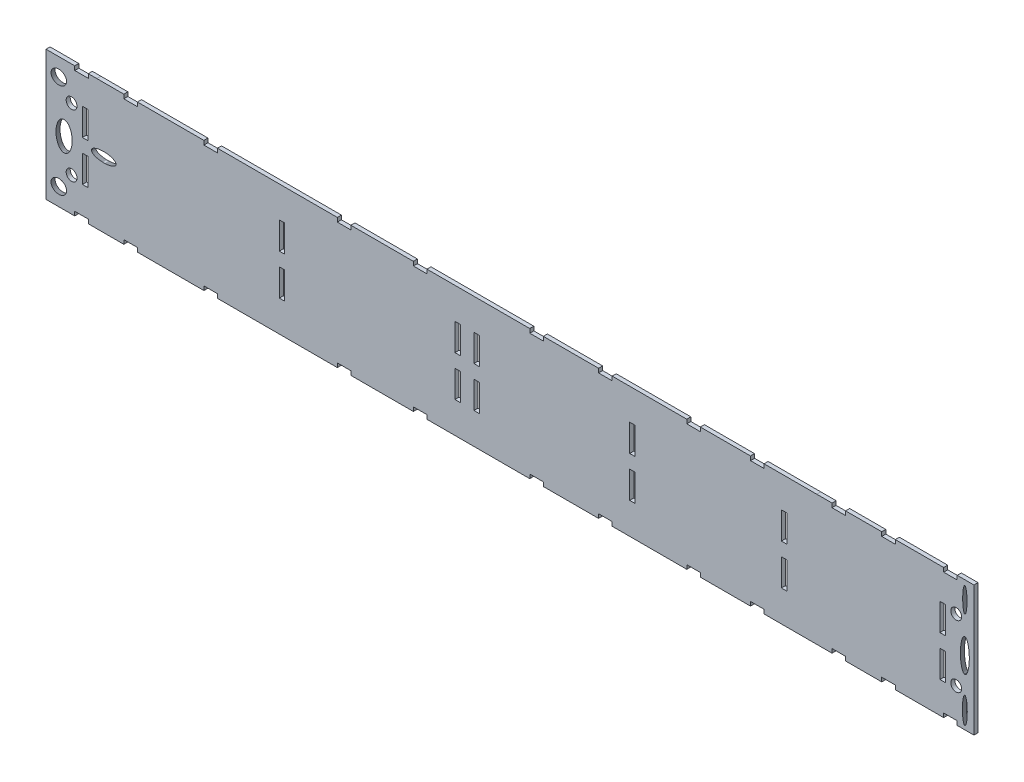
from build123d import *

# Parameters (mm, degrees)
MODEL_R         = 2
MODEL_W         = 2
MODEL_H         = 10
EXTRUDE_1_DEPTH = 1.5


with BuildPart() as part:
    # Model → 凸台-拉伸1 (new body)
    with BuildSketch(Plane.XY):
        Polygon((338.285269169, 1.723672188), (348.246710328, 1.723672188), (348.246710328, 3.223672188), (353.246710328, 3.223672188), (353.246710328, 1.723672188), (377.800303431, 1.723672188), (377.800303431, 3.223677419), (382.800303431, 3.223677419), (382.800303431, 1.723672188), (412.523752943, 1.723672188), (427.042567104, 1.723672188), (427.042567104, 3.223677419), (432.042567104, 3.223677419), (432.042567104, 1.723672188), (436.523752943, 1.723672188), (455.110365553, 1.723672188), (455.110365553, 3.223677419), (460.110365553, 3.223677419), (460.110365553, 1.723672188), (484.606799213, 1.723672188), (498.059086053, 1.723672188), (498.059086053, 3.223677419), (503.059086053, 3.223677419), (503.059086053, 1.723672188), (523.456352673, 1.723672188), (523.456352673, 3.223677419), (528.456352673, 3.223677419), (528.456352673, 1.723672188), (548.298752943, 1.723672188), (556.008423825, 1.723672188), (556.008423825, 3.223677419), (561.008423825, 3.223677419), (561.008423825, 1.723672188), (579.524411936, 1.723672188), (579.524411936, 3.223677419), (584.524411936, 3.223677419), (584.524411936, 1.723672188), (598.298752943, 1.723672188), (609.624868079, 1.723672188), (609.624868079, 3.223672188), (614.624868079, 3.223672188), (614.624868079, 1.723672188), (627.967343665, 1.723672188), (627.967343665, 3.223672188), (632.967343665, 3.223672188), (632.967343665, 1.723672188), (646.116355135, 1.723672188), (650.81890486, 1.723677108), (650.81890486, 3.223682339), (655.81890486, 3.223682339), (655.81890486, 1.723682339), (661.99042954, 1.723688796), (661.990379277, 49.723628095), (655.81890486, 49.723628095), (655.81890486, 48.223628095), (650.81890486, 48.223628095), (650.81890486, 49.723628095), (646.116355234, 49.723628095), (632.967343665, 49.723641853), (632.967343665, 48.223641853), (627.967343665, 48.223641853), (627.967343665, 49.723647084), (614.624868079, 49.723661044), (614.624868079, 48.223661044), (609.624868079, 48.223661044), (609.624868079, 49.723666275), (603.973752943, 49.723672188), (598.298752943, 49.723672188), (584.524411936, 49.723672188), (584.524411936, 48.223672188), (579.524411936, 48.223672188), (579.524411936, 49.723672188), (561.008423825, 49.723672188), (561.008423825, 48.223672188), (556.008423825, 48.223672188), (556.008423825, 49.723672188), (548.298752943, 49.723672188), (528.456352673, 49.723672188), (528.456352673, 48.223672188), (523.456352673, 48.223672188), (523.456352673, 49.723672188), (503.059086053, 49.723672188), (503.059086053, 48.223672188), (498.059086053, 48.223672188), (498.059086053, 49.723672188), (484.606799213, 49.723672188), (460.110365553, 49.723672188), (460.110365553, 48.223672188), (455.110365553, 48.223672188), (455.110365553, 49.723672188), (436.523752943, 49.723672188), (432.042567104, 49.723672188), (432.042567104, 48.223672188), (427.042567104, 48.223672188), (427.042567104, 49.723672188), (412.523752943, 49.723672188), (382.800303431, 49.723672188), (382.800303431, 48.223672188), (377.800303431, 48.223672188), (377.800303431, 49.723672188), (353.246710328, 49.723672188), (353.246710328, 48.223672188), (348.246710328, 48.223672188), (348.246710328, 49.723672188), (338.285269169, 49.723672188), (335.131667994, 49.72371628), (335.131667994, 48.22371628), (330.131667994, 48.22371628), (330.131667994, 49.72371628), (319.523752943, 49.72371628), (319.523752943, 1.72371628), (330.131667994, 1.72371628), (330.131667994, 3.22371628), (335.131667994, 3.22371628), (335.131667994, 1.72371628), align=None)
        with Locations((655.438565964, 14.223656604)):
            Circle(MODEL_R, mode=Mode.SUBTRACT)
        with Locations((655.438571133, 37.223656604)):
            Circle(MODEL_R, mode=Mode.SUBTRACT)
        with Locations((328.963055855, 37.223694234)):
            Circle(MODEL_R, mode=Mode.SUBTRACT)
        with Locations((328.963055855, 14.223694234)):
            Circle(MODEL_R, mode=Mode.SUBTRACT)
        with Locations((406.620149255, 33.223672188)):
            Rectangle(MODEL_W, MODEL_H, mode=Mode.SUBTRACT)
        with Locations((406.620149255, 18.223672188)):
            Rectangle(MODEL_W, MODEL_H, mode=Mode.SUBTRACT)
        with Locations((591.928319664, 33.223672188)):
            Rectangle(MODEL_W, MODEL_H, mode=Mode.SUBTRACT)
        with Locations((591.928319664, 18.223672188)):
            Rectangle(MODEL_W, MODEL_H, mode=Mode.SUBTRACT)
        with Locations((471.459111563, 33.223672188)):
            Rectangle(MODEL_W, MODEL_H, mode=Mode.SUBTRACT)
        with Locations((471.459111563, 18.223672188)):
            Rectangle(MODEL_W, MODEL_H, mode=Mode.SUBTRACT)
        with Locations((478.459111563, 33.223672188)):
            Rectangle(MODEL_W, MODEL_H, mode=Mode.SUBTRACT)
        with Locations((478.459111563, 18.223672188)):
            Rectangle(MODEL_W, MODEL_H, mode=Mode.SUBTRACT)
        with Locations((535.952910082, 33.223672188)):
            Rectangle(MODEL_W, MODEL_H, mode=Mode.SUBTRACT)
        with Locations((535.952910082, 18.223672188)):
            Rectangle(MODEL_W, MODEL_H, mode=Mode.SUBTRACT)
        with Locations((333.962643836, 18.22371628)):
            Rectangle(MODEL_W, MODEL_H, mode=Mode.SUBTRACT)
        with Locations((333.962643836, 33.22371628)):
            Rectangle(MODEL_W, MODEL_H, mode=Mode.SUBTRACT)
        with Locations((650.439397184, 33.223628095)):
            Rectangle(MODEL_W, MODEL_H, mode=Mode.SUBTRACT)
        with Locations((650.439397184, 18.223628095)):
            Rectangle(MODEL_W, MODEL_H, mode=Mode.SUBTRACT)
        Polygon((345.366429852, 25.861922765), (345.360429852, 25.771922765), (345.344429852, 25.691922765), (345.316429852, 25.601922765), (345.278429852, 25.511922765), (345.230429852, 25.431922765), (345.170429852, 25.341922765), (345.100429852, 25.261922765), (345.020429852, 25.181922765), (344.930429852, 25.101922765), (344.829429852, 25.021922765), (344.720429852, 24.941922765), (344.600429852, 24.871922765), (344.472429852, 24.801922765), (344.335429852, 24.731922765), (344.189429852, 24.661922765), (344.036429852, 24.601922765), (343.874429852, 24.541922765), (343.705429852, 24.481922765), (343.530429852, 24.431922765), (343.347429852, 24.381922765), (343.159429852, 24.331922765), (342.965429852, 24.291922765), (342.766429852, 24.251922765), (342.562429852, 24.211922765), (342.354429852, 24.181922765), (342.143429852, 24.151922765), (341.928429852, 24.131922765), (341.710429852, 24.111922765), (341.491429852, 24.101922765), (341.270429852, 24.081922765), (341.047429852, 24.081922765), (340.825429852, 24.081922765), (340.602429852, 24.081922765), (340.379429852, 24.081922765), (340.158429852, 24.101922765), (339.939429852, 24.111922765), (339.721429852, 24.131922765), (339.506429852, 24.151922765), (339.295429852, 24.181922765), (339.087429852, 24.211922765), (338.883429852, 24.251922765), (338.684429852, 24.291922765), (338.490429852, 24.331922765), (338.302429852, 24.381922765), (338.119429852, 24.431922765), (337.944429852, 24.481922765), (337.775429852, 24.541922765), (337.613429852, 24.601922765), (337.460429852, 24.661922765), (337.314429852, 24.731922765), (337.177429852, 24.801922765), (337.049429852, 24.871922765), (336.929429852, 24.941922765), (336.820429852, 25.021922765), (336.719429852, 25.101922765), (336.629429852, 25.181922765), (336.549429852, 25.261922765), (336.479429852, 25.341922765), (336.419429852, 25.431922765), (336.371429852, 25.511922765), (336.333429852, 25.601922765), (336.305429852, 25.691922765), (336.289429852, 25.771922765), (336.283429852, 25.861922765), (336.289429852, 25.951922765), (336.305429852, 26.041922765), (336.333429852, 26.121922765), (336.371429852, 26.211922765), (336.419429852, 26.291922765), (336.479429852, 26.381922765), (336.549429852, 26.461922765), (336.629429852, 26.541922765), (336.719429852, 26.621922765), (336.820429852, 26.701922765), (336.929429852, 26.781922765), (337.049429852, 26.851922765), (337.177429852, 26.921922765), (337.314429852, 26.991922765), (337.460429852, 27.061922765), (337.613429852, 27.121922765), (337.775429852, 27.181922765), (337.944429852, 27.241922765), (338.119429852, 27.291922765), (338.302429852, 27.341922765), (338.490429852, 27.391922765), (338.684429852, 27.431922765), (338.883429852, 27.471922765), (339.087429852, 27.511922765), (339.295429852, 27.541922765), (339.506429852, 27.571922765), (339.721429852, 27.591922765), (339.939429852, 27.611922765), (340.158429852, 27.631922765), (340.379429852, 27.641922765), (340.602429852, 27.641922765), (340.825429852, 27.651922765), (341.047429852, 27.641922765), (341.270429852, 27.641922765), (341.491429852, 27.631922765), (341.710429852, 27.611922765), (341.928429852, 27.591922765), (342.143429852, 27.571922765), (342.354429852, 27.541922765), (342.562429852, 27.511922765), (342.766429852, 27.471922765), (342.965429852, 27.431922765), (343.159429852, 27.391922765), (343.347429852, 27.341922765), (343.530429852, 27.291922765), (343.705429852, 27.241922765), (343.874429852, 27.181922765), (344.036429852, 27.121922765), (344.189429852, 27.061922765), (344.335429852, 26.991922765), (344.472429852, 26.921922765), (344.600429852, 26.851922765), (344.720429852, 26.781922765), (344.829429852, 26.701922765), (344.930429852, 26.621922765), (345.020429852, 26.541922765), (345.100429852, 26.461922765), (345.170429852, 26.381922765), (345.230429852, 26.291922765), (345.278429852, 26.211922765), (345.316429852, 26.121922765), (345.344429852, 26.041922765), (345.360429852, 25.951922765), align=None, mode=Mode.SUBTRACT)
        Polygon((326.195429852, 19.921922765), (326.049429852, 19.921922765), (325.902429852, 19.941922765), (325.757429852, 19.981922765), (325.612429852, 20.021922765), (325.469429852, 20.081922765), (325.328429852, 20.151922765), (325.189429852, 20.231922765), (325.052429852, 20.321922765), (324.918429852, 20.431922765), (324.787429852, 20.551922765), (324.660429852, 20.681922765), (324.536429852, 20.821922765), (324.416429852, 20.971922765), (324.300429852, 21.131922765), (324.189429852, 21.301922765), (324.083429852, 21.481922765), (323.982429852, 21.671922765), (323.886429852, 21.871922765), (323.796429852, 22.081922765), (323.712429852, 22.291922765), (323.633429852, 22.511922765), (323.561429852, 22.741922765), (323.495429852, 22.981922765), (323.436429852, 23.221922765), (323.383429852, 23.461922765), (323.337429852, 23.711922765), (323.298429852, 23.961922765), (323.266429852, 24.221922765), (323.241429852, 24.481922765), (323.223429852, 24.741922765), (323.212429852, 25.001922765), (323.208429852, 25.261922765), (323.212429852, 25.521922765), (323.223429852, 25.791922765), (323.241429852, 26.051922765), (323.266429852, 26.301922765), (323.298429852, 26.561922765), (323.337429852, 26.811922765), (323.383429852, 27.061922765), (323.436429852, 27.311922765), (323.495429852, 27.551922765), (323.561429852, 27.781922765), (323.633429852, 28.011922765), (323.712429852, 28.231922765), (323.796429852, 28.451922765), (323.886429852, 28.651922765), (323.982429852, 28.851922765), (324.083429852, 29.041922765), (324.189429852, 29.221922765), (324.300429852, 29.391922765), (324.416429852, 29.551922765), (324.536429852, 29.711922765), (324.660429852, 29.851922765), (324.787429852, 29.981922765), (324.918429852, 30.091922765), (325.052429852, 30.201922765), (325.189429852, 30.291922765), (325.328429852, 30.381922765), (325.469429852, 30.451922765), (325.612429852, 30.501922765), (325.757429852, 30.551922765), (325.902429852, 30.581922765), (326.049429852, 30.601922765), (326.195429852, 30.611922765), (326.342429852, 30.601922765), (326.488429852, 30.581922765), (326.633429852, 30.551922765), (326.778429852, 30.501922765), (326.921429852, 30.451922765), (327.062429852, 30.381922765), (327.201429852, 30.291922765), (327.338429852, 30.201922765), (327.472429852, 30.091922765), (327.603429852, 29.981922765), (327.731429852, 29.851922765), (327.855429852, 29.711922765), (327.974429852, 29.551922765), (328.090429852, 29.391922765), (328.201429852, 29.221922765), (328.307429852, 29.041922765), (328.408429852, 28.851922765), (328.504429852, 28.651922765), (328.594429852, 28.451922765), (328.679429852, 28.231922765), (328.757429852, 28.011922765), (328.829429852, 27.781922765), (328.895429852, 27.551922765), (328.955429852, 27.311922765), (329.008429852, 27.061922765), (329.053429852, 26.811922765), (329.093429852, 26.561922765), (329.125429852, 26.301922765), (329.150429852, 26.051922765), (329.168429852, 25.791922765), (329.179429852, 25.521922765), (329.182429852, 25.261922765), (329.179429852, 25.001922765), (329.168429852, 24.741922765), (329.150429852, 24.481922765), (329.125429852, 24.221922765), (329.093429852, 23.961922765), (329.053429852, 23.711922765), (329.008429852, 23.461922765), (328.955429852, 23.221922765), (328.895429852, 22.981922765), (328.829429852, 22.741922765), (328.757429852, 22.511922765), (328.679429852, 22.291922765), (328.594429852, 22.081922765), (328.504429852, 21.871922765), (328.408429852, 21.671922765), (328.307429852, 21.481922765), (328.201429852, 21.301922765), (328.090429852, 21.131922765), (327.974429852, 20.971922765), (327.855429852, 20.821922765), (327.731429852, 20.681922765), (327.603429852, 20.551922765), (327.472429852, 20.431922765), (327.338429852, 20.321922765), (327.201429852, 20.231922765), (327.062429852, 20.151922765), (326.921429852, 20.081922765), (326.778429852, 20.021922765), (326.633429852, 19.981922765), (326.488429852, 19.941922765), (326.342429852, 19.921922765), align=None, mode=Mode.SUBTRACT)
        Polygon((321.382429852, 8.251922765), (321.385429852, 8.371922765), (321.396429852, 8.501922765), (321.413429852, 8.621922765), (321.437429852, 8.741922765), (321.468429852, 8.871922765), (321.505429852, 8.991922765), (321.549429852, 9.101922765), (321.600429852, 9.221922765), (321.657429852, 9.331922765), (321.720429852, 9.441922765), (321.789429852, 9.551922765), (321.865429852, 9.661922765), (321.945429852, 9.761922765), (322.032429852, 9.861922765), (322.124429852, 9.951922765), (322.221429852, 10.041922765), (322.322429852, 10.131922765), (322.429429852, 10.211922765), (322.540429852, 10.281922765), (322.654429852, 10.361922765), (322.773429852, 10.421922765), (322.895429852, 10.481922765), (323.021429852, 10.541922765), (323.149429852, 10.591922765), (323.281429852, 10.641922765), (323.414429852, 10.671922765), (323.549429852, 10.711922765), (323.687429852, 10.731922765), (323.825429852, 10.761922765), (323.965429852, 10.771922765), (324.105429852, 10.781922765), (324.245429852, 10.781922765), (324.386429852, 10.781922765), (324.526429852, 10.771922765), (324.665429852, 10.761922765), (324.804429852, 10.731922765), (324.941429852, 10.711922765), (325.076429852, 10.671922765), (325.210429852, 10.641922765), (325.341429852, 10.591922765), (325.469429852, 10.541922765), (325.595429852, 10.481922765), (325.717429852, 10.421922765), (325.836429852, 10.361922765), (325.951429852, 10.281922765), (326.062429852, 10.211922765), (326.168429852, 10.131922765), (326.270429852, 10.041922765), (326.367429852, 9.951922765), (326.458429852, 9.861922765), (326.545429852, 9.761922765), (326.626429852, 9.661922765), (326.701429852, 9.551922765), (326.770429852, 9.441922765), (326.833429852, 9.331922765), (326.890429852, 9.221922765), (326.941429852, 9.101922765), (326.985429852, 8.991922765), (327.023429852, 8.871922765), (327.053429852, 8.741922765), (327.077429852, 8.621922765), (327.095429852, 8.501922765), (327.105429852, 8.371922765), (327.108429852, 8.251922765), (327.105429852, 8.131922765), (327.095429852, 8.001922765), (327.077429852, 7.881922765), (327.053429852, 7.761922765), (327.023429852, 7.631922765), (326.985429852, 7.511922765), (326.941429852, 7.401922765), (326.890429852, 7.281922765), (326.833429852, 7.171922765), (326.770429852, 7.061922765), (326.701429852, 6.951922765), (326.626429852, 6.841922765), (326.545429852, 6.741922765), (326.458429852, 6.641922765), (326.367429852, 6.551922765), (326.270429852, 6.461922765), (326.168429852, 6.371922765), (326.062429852, 6.291922765), (325.951429852, 6.211922765), (325.836429852, 6.141922765), (325.717429852, 6.081922765), (325.595429852, 6.021922765), (325.469429852, 5.961922765), (325.341429852, 5.911922765), (325.210429852, 5.861922765), (325.076429852, 5.831922765), (324.941429852, 5.791922765), (324.804429852, 5.761922765), (324.665429852, 5.741922765), (324.526429852, 5.731922765), (324.386429852, 5.721922765), (324.245429852, 5.721922765), (324.105429852, 5.721922765), (323.965429852, 5.731922765), (323.825429852, 5.741922765), (323.687429852, 5.761922765), (323.549429852, 5.791922765), (323.414429852, 5.831922765), (323.281429852, 5.861922765), (323.149429852, 5.911922765), (323.021429852, 5.961922765), (322.895429852, 6.021922765), (322.773429852, 6.081922765), (322.654429852, 6.141922765), (322.540429852, 6.211922765), (322.429429852, 6.291922765), (322.322429852, 6.371922765), (322.221429852, 6.461922765), (322.124429852, 6.551922765), (322.032429852, 6.641922765), (321.945429852, 6.741922765), (321.865429852, 6.841922765), (321.789429852, 6.951922765), (321.720429852, 7.061922765), (321.657429852, 7.171922765), (321.600429852, 7.281922765), (321.549429852, 7.401922765), (321.505429852, 7.511922765), (321.468429852, 7.631922765), (321.437429852, 7.761922765), (321.413429852, 7.881922765), (321.396429852, 8.001922765), (321.385429852, 8.131922765), align=None, mode=Mode.SUBTRACT)
        Polygon((321.382429852, 43.191922765), (321.385429852, 43.071922765), (321.396429852, 42.951922765), (321.413429852, 42.821922765), (321.437429852, 42.701922765), (321.468429852, 42.581922765), (321.505429852, 42.461922765), (321.549429852, 42.341922765), (321.600429852, 42.221922765), (321.657429852, 42.111922765), (321.720429852, 42.001922765), (321.789429852, 41.891922765), (321.865429852, 41.791922765), (321.945429852, 41.681922765), (322.032429852, 41.591922765), (322.124429852, 41.491922765), (322.221429852, 41.401922765), (322.322429852, 41.321922765), (322.429429852, 41.241922765), (322.540429852, 41.161922765), (322.655429852, 41.091922765), (322.773429852, 41.021922765), (322.896429852, 40.961922765), (323.021429852, 40.901922765), (323.150429852, 40.851922765), (323.281429852, 40.811922765), (323.414429852, 40.771922765), (323.550429852, 40.741922765), (323.687429852, 40.711922765), (323.825429852, 40.691922765), (323.965429852, 40.671922765), (324.105429852, 40.661922765), (324.245429852, 40.661922765), (324.386429852, 40.661922765), (324.526429852, 40.671922765), (324.665429852, 40.691922765), (324.804429852, 40.711922765), (324.941429852, 40.741922765), (325.076429852, 40.771922765), (325.210429852, 40.811922765), (325.341429852, 40.851922765), (325.469429852, 40.901922765), (325.595429852, 40.961922765), (325.717429852, 41.021922765), (325.836429852, 41.091922765), (325.951429852, 41.161922765), (326.062429852, 41.241922765), (326.168429852, 41.321922765), (326.270429852, 41.401922765), (326.367429852, 41.491922765), (326.458429852, 41.591922765), (326.545429852, 41.681922765), (326.626429852, 41.791922765), (326.701429852, 41.891922765), (326.770429852, 42.001922765), (326.833429852, 42.111922765), (326.890429852, 42.221922765), (326.941429852, 42.341922765), (326.985429852, 42.461922765), (327.023429852, 42.581922765), (327.053429852, 42.701922765), (327.077429852, 42.821922765), (327.095429852, 42.951922765), (327.105429852, 43.071922765), (327.108429852, 43.191922765), (327.105429852, 43.321922765), (327.095429852, 43.441922765), (327.077429852, 43.571922765), (327.053429852, 43.691922765), (327.023429852, 43.811922765), (326.985429852, 43.931922765), (326.941429852, 44.051922765), (326.890429852, 44.161922765), (326.833429852, 44.281922765), (326.770429852, 44.391922765), (326.701429852, 44.501922765), (326.626429852, 44.601922765), (326.545429852, 44.701922765), (326.458429852, 44.801922765), (326.367429852, 44.901922765), (326.270429852, 44.991922765), (326.168429852, 45.071922765), (326.062429852, 45.151922765), (325.951429852, 45.231922765), (325.836429852, 45.301922765), (325.717429852, 45.371922765), (325.595429852, 45.431922765), (325.469429852, 45.481922765), (325.341429852, 45.531922765), (325.210429852, 45.581922765), (325.076429852, 45.621922765), (324.941429852, 45.651922765), (324.804429852, 45.681922765), (324.665429852, 45.701922765), (324.526429852, 45.721922765), (324.386429852, 45.721922765), (324.245429852, 45.731922765), (324.105429852, 45.721922765), (323.965429852, 45.721922765), (323.825429852, 45.701922765), (323.687429852, 45.681922765), (323.550429852, 45.651922765), (323.414429852, 45.621922765), (323.281429852, 45.581922765), (323.150429852, 45.531922765), (323.021429852, 45.481922765), (322.896429852, 45.431922765), (322.773429852, 45.371922765), (322.655429852, 45.301922765), (322.540429852, 45.231922765), (322.429429852, 45.151922765), (322.322429852, 45.071922765), (322.221429852, 44.991922765), (322.124429852, 44.901922765), (322.032429852, 44.801922765), (321.945429852, 44.701922765), (321.865429852, 44.601922765), (321.789429852, 44.501922765), (321.720429852, 44.391922765), (321.657429852, 44.281922765), (321.600429852, 44.161922765), (321.549429852, 44.051922765), (321.505429852, 43.931922765), (321.468429852, 43.811922765), (321.437429852, 43.691922765), (321.413429852, 43.571922765), (321.396429852, 43.441922765), (321.385429852, 43.321922765), align=None, mode=Mode.SUBTRACT)
        Polygon((658.632114556, 31.512707321), (658.552114556, 31.512707321), (658.471114556, 31.492707321), (658.391114556, 31.452707321), (658.312114556, 31.402707321), (658.233114556, 31.332707321), (658.156114556, 31.252707321), (658.079114556, 31.162707321), (658.004114556, 31.062707321), (657.931114556, 30.932707321), (657.859114556, 30.802707321), (657.789114556, 30.662707321), (657.721114556, 30.502707321), (657.655114556, 30.332707321), (657.591114556, 30.142707321), (657.530114556, 29.952707321), (657.472114556, 29.752707321), (657.417114556, 29.532707321), (657.364114556, 29.312707321), (657.314114556, 29.072707321), (657.268114556, 28.832707321), (657.225114556, 28.582707321), (657.185114556, 28.322707321), (657.149114556, 28.062707321), (657.116114556, 27.792707321), (657.088114556, 27.512707321), (657.062114556, 27.232707321), (657.041114556, 26.952707321), (657.023114556, 26.662707321), (657.009114556, 26.362707321), (657.000114556, 26.072707321), (656.994114556, 25.782707321), (656.992114556, 25.482707321), (656.994114556, 25.182707321), (657.000114556, 24.892707321), (657.009114556, 24.592707321), (657.023114556, 24.302707321), (657.041114556, 24.012707321), (657.062114556, 23.732707321), (657.088114556, 23.452707321), (657.116114556, 23.172707321), (657.149114556, 22.902707321), (657.185114556, 22.632707321), (657.225114556, 22.382707321), (657.268114556, 22.132707321), (657.314114556, 21.882707321), (657.364114556, 21.652707321), (657.417114556, 21.432707321), (657.472114556, 21.212707321), (657.530114556, 21.012707321), (657.591114556, 20.812707321), (657.655114556, 20.632707321), (657.721114556, 20.462707321), (657.789114556, 20.302707321), (657.859114556, 20.162707321), (657.931114556, 20.022707321), (658.004114556, 19.902707321), (658.079114556, 19.802707321), (658.156114556, 19.702707321), (658.233114556, 19.632707321), (658.312114556, 19.562707321), (658.391114556, 19.512707321), (658.471114556, 19.472707321), (658.552114556, 19.452707321), (658.632114556, 19.442707321), (658.712114556, 19.452707321), (658.793114556, 19.472707321), (658.873114556, 19.512707321), (658.952114556, 19.562707321), (659.031114556, 19.632707321), (659.108114556, 19.702707321), (659.185114556, 19.802707321), (659.260114556, 19.902707321), (659.333114556, 20.022707321), (659.405114556, 20.162707321), (659.475114556, 20.302707321), (659.543114556, 20.462707321), (659.609114556, 20.632707321), (659.673114556, 20.812707321), (659.734114556, 21.012707321), (659.792114556, 21.212707321), (659.847114556, 21.432707321), (659.900114556, 21.652707321), (659.950114556, 21.882707321), (659.996114556, 22.132707321), (660.039114556, 22.382707321), (660.079114556, 22.632707321), (660.115114556, 22.902707321), (660.147114556, 23.172707321), (660.176114556, 23.452707321), (660.202114556, 23.732707321), (660.223114556, 24.012707321), (660.241114556, 24.302707321), (660.255114556, 24.592707321), (660.264114556, 24.892707321), (660.270114556, 25.182707321), (660.272114556, 25.482707321), (660.270114556, 25.782707321), (660.264114556, 26.072707321), (660.255114556, 26.362707321), (660.241114556, 26.662707321), (660.223114556, 26.952707321), (660.202114556, 27.232707321), (660.176114556, 27.512707321), (660.147114556, 27.792707321), (660.115114556, 28.062707321), (660.079114556, 28.322707321), (660.039114556, 28.582707321), (659.996114556, 28.832707321), (659.950114556, 29.072707321), (659.900114556, 29.312707321), (659.847114556, 29.532707321), (659.792114556, 29.752707321), (659.734114556, 29.952707321), (659.673114556, 30.142707321), (659.609114556, 30.332707321), (659.543114556, 30.502707321), (659.475114556, 30.662707321), (659.405114556, 30.802707321), (659.333114556, 30.932707321), (659.260114556, 31.062707321), (659.185114556, 31.162707321), (659.108114556, 31.252707321), (659.031114556, 31.332707321), (658.952114556, 31.402707321), (658.873114556, 31.452707321), (658.793114556, 31.492707321), (658.712114556, 31.512707321), align=None, mode=Mode.SUBTRACT)
        Polygon((658.632114556, 12.812707321), (658.588114556, 12.812707321), (658.545114556, 12.792707321), (658.501114556, 12.762707321), (658.458114556, 12.722707321), (658.415114556, 12.672707321), (658.373114556, 12.602707321), (658.331114556, 12.532707321), (658.290114556, 12.442707321), (658.250114556, 12.342707321), (658.211114556, 12.242707321), (658.173114556, 12.122707321), (658.136114556, 11.992707321), (658.100114556, 11.852707321), (658.066114556, 11.712707321), (658.033114556, 11.552707321), (658.001114556, 11.392707321), (657.971114556, 11.212707321), (657.942114556, 11.032707321), (657.915114556, 10.842707321), (657.890114556, 10.652707321), (657.866114556, 10.452707321), (657.845114556, 10.242707321), (657.825114556, 10.032707321), (657.807114556, 9.812707321), (657.792114556, 9.592707321), (657.778114556, 9.362707321), (657.766114556, 9.132707321), (657.757114556, 8.902707321), (657.749114556, 8.662707321), (657.744114556, 8.422707321), (657.741114556, 8.192707321), (657.739114556, 7.952707321), (657.741114556, 7.712707321), (657.744114556, 7.472707321), (657.749114556, 7.232707321), (657.757114556, 7.002707321), (657.766114556, 6.762707321), (657.778114556, 6.532707321), (657.792114556, 6.312707321), (657.807114556, 6.082707321), (657.825114556, 5.872707321), (657.845114556, 5.652707321), (657.866114556, 5.452707321), (657.890114556, 5.242707321), (657.915114556, 5.052707321), (657.942114556, 4.862707321), (657.971114556, 4.682707321), (658.001114556, 4.512707321), (658.033114556, 4.342707321), (658.066114556, 4.192707321), (658.100114556, 4.042707321), (658.136114556, 3.902707321), (658.173114556, 3.772707321), (658.211114556, 3.662707321), (658.250114556, 3.552707321), (658.290114556, 3.452707321), (658.331114556, 3.372707321), (658.373114556, 3.292707321), (658.415114556, 3.232707321), (658.458114556, 3.182707321), (658.501114556, 3.132707321), (658.545114556, 3.112707321), (658.588114556, 3.092707321), (658.632114556, 3.082707321), (658.676114556, 3.092707321), (658.719114556, 3.112707321), (658.763114556, 3.132707321), (658.806114556, 3.182707321), (658.849114556, 3.232707321), (658.891114556, 3.292707321), (658.933114556, 3.372707321), (658.974114556, 3.452707321), (659.014114556, 3.552707321), (659.053114556, 3.662707321), (659.091114556, 3.772707321), (659.128114556, 3.902707321), (659.164114556, 4.042707321), (659.198114556, 4.192707321), (659.231114556, 4.342707321), (659.263114556, 4.512707321), (659.293114556, 4.682707321), (659.322114556, 4.862707321), (659.349114556, 5.052707321), (659.374114556, 5.242707321), (659.398114556, 5.452707321), (659.419114556, 5.652707321), (659.439114556, 5.872707321), (659.457114556, 6.082707321), (659.472114556, 6.312707321), (659.486114556, 6.532707321), (659.498114556, 6.762707321), (659.507114556, 7.002707321), (659.515114556, 7.232707321), (659.520114556, 7.472707321), (659.523114556, 7.712707321), (659.525114556, 7.952707321), (659.523114556, 8.192707321), (659.520114556, 8.422707321), (659.515114556, 8.662707321), (659.507114556, 8.902707321), (659.498114556, 9.132707321), (659.486114556, 9.362707321), (659.472114556, 9.592707321), (659.457114556, 9.812707321), (659.439114556, 10.032707321), (659.419114556, 10.242707321), (659.398114556, 10.452707321), (659.374114556, 10.652707321), (659.349114556, 10.842707321), (659.322114556, 11.032707321), (659.293114556, 11.212707321), (659.263114556, 11.392707321), (659.231114556, 11.552707321), (659.198114556, 11.712707321), (659.164114556, 11.852707321), (659.128114556, 11.992707321), (659.091114556, 12.122707321), (659.053114556, 12.242707321), (659.014114556, 12.342707321), (658.974114556, 12.442707321), (658.933114556, 12.532707321), (658.891114556, 12.602707321), (658.849114556, 12.672707321), (658.806114556, 12.722707321), (658.763114556, 12.762707321), (658.719114556, 12.792707321), (658.676114556, 12.812707321), align=None, mode=Mode.SUBTRACT)
        Polygon((658.632114556, 47.892707321), (658.593114556, 47.892707321), (658.555114556, 47.872707321), (658.516114556, 47.842707321), (658.478114556, 47.812707321), (658.440114556, 47.762707321), (658.403114556, 47.702707321), (658.366114556, 47.632707321), (658.330114556, 47.542707321), (658.295114556, 47.452707321), (658.260114556, 47.352707321), (658.226114556, 47.242707321), (658.194114556, 47.122707321), (658.162114556, 46.992707321), (658.131114556, 46.852707321), (658.102114556, 46.702707321), (658.074114556, 46.552707321), (658.047114556, 46.382707321), (658.022114556, 46.212707321), (657.998114556, 46.032707321), (657.976114556, 45.852707321), (657.955114556, 45.662707321), (657.936114556, 45.462707321), (657.919114556, 45.262707321), (657.903114556, 45.052707321), (657.889114556, 44.842707321), (657.877114556, 44.632707321), (657.867114556, 44.412707321), (657.858114556, 44.192707321), (657.851114556, 43.962707321), (657.847114556, 43.742707321), (657.844114556, 43.512707321), (657.843114556, 43.292707321), (657.844114556, 43.062707321), (657.847114556, 42.842707321), (657.851114556, 42.612707321), (657.858114556, 42.392707321), (657.867114556, 42.172707321), (657.877114556, 41.952707321), (657.889114556, 41.742707321), (657.903114556, 41.532707321), (657.919114556, 41.322707321), (657.936114556, 41.122707321), (657.955114556, 40.922707321), (657.976114556, 40.732707321), (657.998114556, 40.542707321), (658.022114556, 40.372707321), (658.047114556, 40.192707321), (658.074114556, 40.032707321), (658.102114556, 39.872707321), (658.131114556, 39.732707321), (658.162114556, 39.592707321), (658.194114556, 39.462707321), (658.226114556, 39.342707321), (658.260114556, 39.232707321), (658.295114556, 39.122707321), (658.330114556, 39.032707321), (658.366114556, 38.952707321), (658.403114556, 38.882707321), (658.440114556, 38.822707321), (658.478114556, 38.772707321), (658.516114556, 38.732707321), (658.555114556, 38.702707321), (658.593114556, 38.692707321), (658.632114556, 38.682707321), (658.671114556, 38.692707321), (658.709114556, 38.702707321), (658.748114556, 38.732707321), (658.786114556, 38.772707321), (658.824114556, 38.822707321), (658.861114556, 38.882707321), (658.898114556, 38.952707321), (658.934114556, 39.032707321), (658.969114556, 39.122707321), (659.004114556, 39.232707321), (659.038114556, 39.342707321), (659.070114556, 39.462707321), (659.102114556, 39.592707321), (659.133114556, 39.732707321), (659.162114556, 39.872707321), (659.190114556, 40.032707321), (659.217114556, 40.192707321), (659.242114556, 40.372707321), (659.266114556, 40.542707321), (659.288114556, 40.732707321), (659.309114556, 40.922707321), (659.328114556, 41.122707321), (659.345114556, 41.322707321), (659.361114556, 41.532707321), (659.375114556, 41.742707321), (659.387114556, 41.952707321), (659.397114556, 42.172707321), (659.406114556, 42.392707321), (659.413114556, 42.612707321), (659.417114556, 42.842707321), (659.420114556, 43.062707321), (659.421114556, 43.292707321), (659.420114556, 43.512707321), (659.417114556, 43.742707321), (659.413114556, 43.962707321), (659.406114556, 44.192707321), (659.397114556, 44.412707321), (659.387114556, 44.632707321), (659.375114556, 44.842707321), (659.361114556, 45.052707321), (659.345114556, 45.262707321), (659.328114556, 45.462707321), (659.309114556, 45.662707321), (659.288114556, 45.852707321), (659.266114556, 46.032707321), (659.242114556, 46.212707321), (659.217114556, 46.382707321), (659.190114556, 46.552707321), (659.162114556, 46.702707321), (659.133114556, 46.852707321), (659.102114556, 46.992707321), (659.070114556, 47.122707321), (659.038114556, 47.242707321), (659.004114556, 47.352707321), (658.969114556, 47.452707321), (658.934114556, 47.542707321), (658.898114556, 47.632707321), (658.861114556, 47.702707321), (658.824114556, 47.762707321), (658.786114556, 47.812707321), (658.748114556, 47.842707321), (658.709114556, 47.872707321), (658.671114556, 47.892707321), align=None, mode=Mode.SUBTRACT)
    extrude(amount=EXTRUDE_1_DEPTH)


solid = part.part
